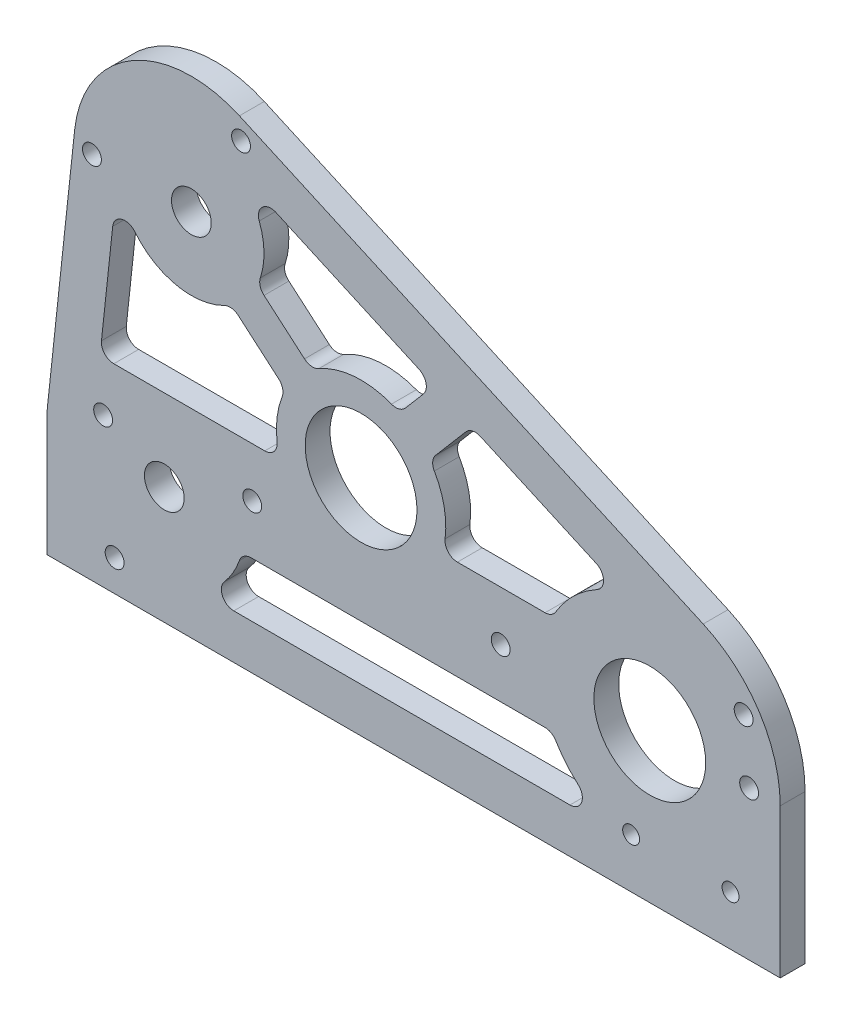
from build123d import *

# Parameters (mm, degrees)
SKETCH1_R           = 14.2875
SKETCH1_R_2         = 12.7
SKETCH1_R_3         = 2.413
SKETCH1_R_4         = 2.159
BOSS_EXTRUDE1_DEPTH = 6.35
BOSS_EXTRUDE2_START = -6.35
SKETCH2_R           = 2.413
SKETCH2_R_2         = 2.685559378
SKETCH2_R_3         = 7.691429031
SKETCH2_R_4         = 5.034548369
SKETCH2_R_5         = 5.920725106
SKETCH2_R_6         = 7.734401209
SKETCH2_R_7         = 5.621863984
SKETCH2_R_8         = 3.605638589
BOSS_EXTRUDE2_DEPTH = 6.35
SKETCH3_R           = 2.413
CUT_EXTRUDE1_DEPTH  = 127.614802212
BOSS_EXTRUDE3_START = -6.35
SKETCH4_R           = 12.7
SKETCH4_R_2         = 5.08
BOSS_EXTRUDE3_DEPTH = 6.35
CUT_EXTRUDE3_DEPTH  = 187.706
FILLET2_R           = 3.175


with BuildPart() as part:
    # Sketch1 → Boss-Extrude1 (new body)
    with BuildSketch(Plane.XY):
        with BuildLine():
            Line((-80.285160074, -57.15), (107.117832745, -57.15))
            Line((107.117832745, -57.15), (107.117832745, -19.05))
            ThreePointArc((107.117832745, -19.05), (101.76765184, -0.936500169), (87.434360611, 11.363096345))
            Line((87.434360611, 11.363096345), (-31.091183717, 64.575405501))
            ThreePointArc((-31.091183717, 64.575405501), (-58.306442976, 63.227904236), (-73.203178923, 40.411827573))
            Line((-73.203178923, 40.411827573), (-80.113730967, -23.950184188))
            ThreePointArc((-80.113730967, -23.950184188), (-80.242272138, -25.549099535), (-80.285160074, -27.1526))
            Line((-80.285160074, -27.1526), (-80.285160074, -57.15))
        make_face()
        Circle(SKETCH1_R, mode=Mode.SUBTRACT)
        with Locations((-43.377208029, 37.209411761)):
            Circle(SKETCH1_R_2, mode=Mode.SUBTRACT)
        with Locations((-50.287760074, -27.1526)):
            Circle(SKETCH1_R_2, mode=Mode.SUBTRACT)
        with Locations((73.780332745, -19.05)):
            Circle(SKETCH1_R, mode=Mode.SUBTRACT)
        with Locations((-68.777208029, 37.209411761)):
            Circle(SKETCH1_R_3, mode=Mode.SUBTRACT)
        with Locations((-17.977208029, 37.209411761)):
            Circle(SKETCH1_R_3, mode=Mode.SUBTRACT)
        with Locations((-56.077208029, 59.206457017)):
            Circle(SKETCH1_R_3, mode=Mode.SUBTRACT)
        with Locations((-30.677208029, 59.206457017)):
            Circle(SKETCH1_R_3, mode=Mode.SUBTRACT)
        with Locations((-56.077208029, 15.212366505)):
            Circle(SKETCH1_R_3, mode=Mode.SUBTRACT)
        with Locations((-30.677208029, 15.212366505)):
            Circle(SKETCH1_R_3, mode=Mode.SUBTRACT)
        with Locations((-62.987760074, -5.155554744)):
            Circle(SKETCH1_R_3, mode=Mode.SUBTRACT)
        with Locations((-75.687760074, -27.1526)):
            Circle(SKETCH1_R_3, mode=Mode.SUBTRACT)
        with Locations((-62.987760074, -49.149645256)):
            Circle(SKETCH1_R_3, mode=Mode.SUBTRACT)
        with Locations((-37.587760074, -49.149645256)):
            Circle(SKETCH1_R_3, mode=Mode.SUBTRACT)
        with Locations((-24.887760074, -27.1526)):
            Circle(SKETCH1_R_3, mode=Mode.SUBTRACT)
        with Locations((-37.587760074, -5.155554744)):
            Circle(SKETCH1_R_3, mode=Mode.SUBTRACT)
        with Locations((94.417832745, -44.45)):
            Circle(SKETCH1_R_4, mode=Mode.SUBTRACT)
        with Locations((97.769463398, -3.524143002)):
            Circle(SKETCH1_R_3, mode=Mode.SUBTRACT)
        with Locations((69.017832745, -44.45)):
            Circle(SKETCH1_R_4, mode=Mode.SUBTRACT)
    extrude(amount=BOSS_EXTRUDE1_DEPTH)

    # Sketch2 → Boss-Extrude2 (add)
    with BuildSketch(Plane.XY.offset(6.35).offset(BOSS_EXTRUDE2_START)):
        with Locations((-56.077208029, 59.206457017)):
            Circle(SKETCH2_R)
        with Locations((-17.977208029, 37.209411761)):
            Circle(SKETCH2_R_2)
        with Locations((-30.677208029, 15.212366505)):
            Circle(SKETCH2_R_3)
        with Locations((-56.077208029, 15.212366505)):
            Circle(SKETCH2_R_4)
        with Locations((-75.687760074, -27.1526)):
            Circle(SKETCH2_R)
        with Locations((-37.587760074, -49.149645256)):
            Circle(SKETCH2_R_5)
        with Locations((-24.887760074, -27.1526)):
            Circle(SKETCH2_R_6)
        with Locations((-37.587760074, -5.155554744)):
            Circle(SKETCH2_R_7)
        with Locations((-62.987760074, -5.155554744)):
            Circle(SKETCH2_R_8)
    extrude(amount=BOSS_EXTRUDE2_DEPTH)

    # Sketch3 → Cut-Extrude1 (cut, through all)
    with BuildSketch(Plane.XY.offset(6.35)):
        with Locations((-65.919667255, -19.05)):
            Circle(SKETCH3_R)
        with Locations((-27.819667255, -19.05)):
            Circle(SKETCH3_R)
        with Locations((99.180332745, -19.05)):
            Circle(SKETCH3_R)
        with Locations((35.680332745, -19.05)):
            Circle(SKETCH3_R)
    extrude(amount=-CUT_EXTRUDE1_DEPTH, mode=Mode.SUBTRACT)

    # Sketch4 → Boss-Extrude3 (add)
    # profile 1 of 2: a face of its own
    with BuildSketch(Plane.XY.offset(6.35).offset(BOSS_EXTRUDE3_START)):
        with Locations((-50.287760074, -27.1526)):
            Circle(SKETCH4_R)
        with Locations((-50.287760074, -27.1526)):
            Circle(SKETCH4_R_2, mode=Mode.SUBTRACT)
    # profile 2 of 2: a face of its own
    with BuildSketch(Plane.XY.offset(6.35).offset(BOSS_EXTRUDE3_START)):
        with Locations((-43.377208029, 37.209411761)):
            Circle(SKETCH4_R)
        with Locations((-43.377208029, 37.209411761)):
            Circle(SKETCH4_R_2, mode=Mode.SUBTRACT)
    extrude(amount=BOSS_EXTRUDE3_DEPTH)

    # Sketch6 → Cut-Extrude3 (cut)
    with BuildSketch(Plane.XY.offset(6.35)):
        with BuildLine():
            Line((48.893516959, -31.75), (-30.494672562, -31.75))
            ThreePointArc((-30.494672562, -31.75), (-34.620223563, -40.092101524), (-42.032213015, -45.72))
            Line((-42.032213015, -45.72), (65.452385819, -45.72))
            ThreePointArc((65.452385819, -45.72), (55.763803098, -40.405286453), (48.893516959, -31.75))
        make_face()
        with BuildLine():
            ThreePointArc((21.645969932, 0), (21.406556056, -3.210509638), (20.69361047, -6.35))
            Line((20.69361047, -6.35), (48.893516959, -6.35))
            ThreePointArc((48.893516959, -6.35), (56.358698753, 2.793311769), (66.933289757, 8.038034302))
            Line((66.933289757, 8.038034302), (28.318236786, 25.374349004))
            Line((28.318236786, 25.374349004), (17.519420156, 12.712904141))
            ThreePointArc((17.519420156, 12.712904141), (20.588502328, 6.682932454), (21.645969932, 0))
        make_face()
        with BuildLine():
            Line((-66.728302826, -6.35), (-20.69361047, -6.35))
            ThreePointArc((-20.69361047, -6.35), (-21.56374561, 1.884911026), (-19.278077532, 9.843969777))
            Line((-19.278077532, 9.843969777), (-33.129659603, 21.725998248))
            ThreePointArc((-33.129659603, 21.725998248), (-53.027504153, 21.346873266), (-61.838499073, 39.191601395))
            Line((-61.838499073, 39.191601395), (-66.728302826, -6.35))
        make_face()
        with BuildLine():
            Line((18.662178143, 29.709458205), (-35.7725647, 54.148058182))
            ThreePointArc((-35.7725647, 54.148058182), (-27.789604023, 47.297768619), (-24.809808029, 37.209411761))
            ThreePointArc((-24.809808029, 37.209411761), (-25.241026709, 33.231061615), (-26.514653067, 29.437501898))
            Line((-26.514653067, 29.437501898), (-12.663070997, 17.555473427))
            ThreePointArc((-12.663070997, 17.555473427), (-1.682532329, 21.580479588), (9.789150952, 19.305971562))
            Line((9.789150952, 19.305971562), (18.662178143, 29.709458205))
        make_face()
    extrude(amount=-CUT_EXTRUDE3_DEPTH, mode=Mode.SUBTRACT)

    # Fillet2
    # the kernel refuses this fillet: 3.175 mm, written as the material it adds along each edge
    with BuildSketch(Plane(origin=(-42.032213015, -45.72, 6.35), x_dir=(0.8036425681302507, 0.5951122773805085, 0), z_dir=(0, 0, -1))) as fillet2_piece_1:
        with BuildLine():
            CenterArc((9.520228984, 3.09914538), FILLET2_R, 126.520636513, 130.92989741)
            Line((7.630747504, 5.650710534), (0, 0))
            ThreePointArc((0, 0), (4.415178659, 0.485469569), (8.830357319, 0))
        make_face()
    extrude(amount=6.35)
    with BuildSketch(Plane(origin=(-30.494672562, -31.75, 6.35), x_dir=(1, 0, 0), z_dir=(0, 0, -1))) as fillet2_piece_2:
        with BuildLine():
            CenterArc((2.37907574, 3.175), FILLET2_R, 199.317995786, 70.682004214)
            ThreePointArc((-0.617162538, 2.124675676), (-0.27964227, 1.070743858), (0, 0))
            Line((0, 0), (2.37907574, 0))
        make_face()
    extrude(amount=6.35)
    with BuildSketch(Plane(origin=(48.893516959, -31.75, 6.35), x_dir=(-1, 0, 0), z_dir=(0, 0, -1))) as fillet2_piece_3:
        with BuildLine():
            CenterArc((1.873744746, -3.175), FILLET2_R, 90, 59.322575527)
            ThreePointArc((-0.856924696, -1.555102041), (-0.416105979, -0.784359884), (0, 0))
            Line((0, 0), (1.873744746, 0))
        make_face()
    extrude(amount=6.35)
    with BuildSketch(Plane(origin=(65.452385819, -45.72, 6.35), x_dir=(-1, 0, 0), z_dir=(0, 0, -1))) as fillet2_piece_4:
        with BuildLine():
            CenterArc((12.071273647, 3.175), FILLET2_R, 130.96571333, 139.03428667)
            ThreePointArc((9.989720528, 5.57244898), (5.283086772, 2.269521282), (0, 0))
            Line((0, 0), (12.071273647, 0))
        make_face()
    extrude(amount=6.35)
    with BuildSketch(Plane(origin=(-26.514653067, 29.437501898, 6.35), x_dir=(0.3669458534357753, 0.9302423021161157, 0), z_dir=(0, 0, -1))) as fillet2_piece_5:
        with BuildLine():
            CenterArc((2.262429591, 3.16999522), FILLET2_R, 199.095946459, 67.686577367)
            Line((-0.737856699, 2.131290651), (0, 0))
            ThreePointArc((0, 0), (1.042114701, 0.029267955), (2.084229403, 0))
        make_face()
    extrude(amount=6.35)
    with BuildSketch(Plane(origin=(-35.7725647, 54.148058182, 6.35), x_dir=(0.9122788554907602, -0.40956963977383487, 0), z_dir=(0, 0, -1))) as fillet2_piece_6:
        with BuildLine():
            CenterArc((15.355975384, 3.175), FILLET2_R, 134.932127283, 135.067872717)
            ThreePointArc((13.113572437, 5.422721963), (7.095274757, 1.409153619), (0, 0))
            Line((0, 0), (15.355975384, 0))
        make_face()
    extrude(amount=6.35)
    with BuildSketch(Plane(origin=(18.662178143, 29.709458205, 6.35), x_dir=(-0.6489239587910223, -0.7608532681844692, 0), z_dir=(0, 0, -1))) as fillet2_piece_7:
        with BuildLine():
            CenterArc((FILLET2_R * 1.33387923601, FILLET2_R), FILLET2_R, 163.717281089, 106.282718911)
            Line((FILLET2_R * 0.373989335277, FILLET2_R * 1.28037720746), (0, 0))
            Line((0, 0), (FILLET2_R * 1.33387923601, 0))
        make_face()
    extrude(amount=6.35)
    with BuildSketch(Plane(origin=(9.789150952, 19.305971562, 6.35), x_dir=(0.648923958791122, 0.7608532681843841, 0), z_dir=(0, 0, -1))) as fillet2_piece_8:
        with BuildLine():
            CenterArc((2.366596481, -3.175), FILLET2_R, 90, 70.574451628)
            ThreePointArc((-0.627664905, -2.119053151), (-0.286770358, -1.067542385), (0, 0))
            Line((0, 0), (2.366596481, 0))
        make_face()
    extrude(amount=6.35)
    with BuildSketch(Plane(origin=(-12.663070997, 17.555473427, 6.35), x_dir=(-0.7590062647283117, 0.6510833204000669, 0), z_dir=(0, 0, -1)), Plane(origin=(17.519420156, 12.712904141, 6.35), x_dir=(0.6489239587910582, 0.7608532681844384, 0), z_dir=(0, 0, -1))) as fillet2_piece_9:
        with BuildLine():
            CenterArc((2.366596481, 3.175), FILLET2_R, 199.425548372, 70.574451628)
            ThreePointArc((-0.627664905, 2.119053151), (-0.286770358, 1.067542385), (0, 0))
            Line((0, 0), (2.366596481, 0))
        make_face()
    extrude(amount=6.35)
    with BuildSketch(Plane(origin=(-61.838499073, 39.191601395, 6.35), x_dir=(-0.10675644594996386, -0.9942852011611821, 0), z_dir=(0, 0, -1))) as fillet2_piece_10:
        with BuildLine():
            CenterArc((15.355975384, -3.175), FILLET2_R, 90, 135.067872717)
            ThreePointArc((13.113572437, -5.422721963), (7.095274757, -1.409153619), (0, 0))
            Line((0, 0), (15.355975384, 0))
        make_face()
    extrude(amount=6.35)
    with BuildSketch(Plane(origin=(-33.129659603, 21.725998248, 6.35), x_dir=(0.7590062647282139, -0.6510833204001809, 0), z_dir=(0, 0, -1))) as fillet2_piece_11:
        with BuildLine():
            CenterArc((2.255400706, 3.175), FILLET2_R, 202.313422633, 67.686577367)
            ThreePointArc((-0.681857828, 1.969538551), (-0.313271514, 0.994344318), (0, 0))
            Line((0, 0), (2.255400706, 0))
        make_face()
    extrude(amount=6.35)
    with BuildSketch(Plane(origin=(-19.278077532, 9.843969777, 6.35), x_dir=(-0.40871289434840824, -0.9126630100937293, 0), z_dir=(0, 0, -1))) as fillet2_piece_12:
        with BuildLine():
            CenterArc((2.372140408, 3.170860102), FILLET2_R, 196.499323021, 70.574451628)
            Line((-0.672122904, 2.269147352), (0, 0))
            ThreePointArc((0, 0), (1.105028222, 0.028224283), (2.210056445, 0))
        make_face()
    extrude(amount=6.35)
    with BuildSketch(Plane(origin=(-20.69361047, -6.35, 6.35), x_dir=(-1, 0, 0), z_dir=(0, 0, -1))) as fillet2_piece_13:
        with BuildLine():
            CenterArc((3.923455223, 3.175), FILLET2_R, 172.650815641, 97.349184359)
            ThreePointArc((0.774537845, 3.581133404), (0.463175795, 1.774149345), (0, 0))
            Line((0, 0), (3.923455223, 0))
        make_face()
    extrude(amount=6.35)
    with BuildSketch(Plane(origin=(-66.728302826, -6.35, 6.35), x_dir=(0.10675644594995837, 0.9942852011611827, 0), z_dir=(0, 0, -1))) as fillet2_piece_14:
        with BuildLine():
            CenterArc((FILLET2_R * 1.11311768963, FILLET2_R), FILLET2_R, 173.871627619, 96.128372381)
            Line((FILLET2_R * 0.118832488469, FILLET2_R * 1.10675644595), (0, 0))
            Line((0, 0), (FILLET2_R * 1.11311768963, 0))
        make_face()
    extrude(amount=6.35)
    with BuildSketch(Plane(origin=(66.933289757, 8.038034302, 6.35), x_dir=(-0.9304446977974599, -0.3664323461985766, 0), z_dir=(0, 0, -1))) as fillet2_piece_15:
        with BuildLine():
            CenterArc((7.514267093, 3.149192718), FILLET2_R, 135.673561463, 127.0162006)
            Line((5.242966133, 5.367709553), (0, 0))
            ThreePointArc((0, 0), (3.555137119, 0.227104084), (7.110274239, 0))
        make_face()
    extrude(amount=6.35)
    with BuildSketch(Plane(origin=(48.893516959, -6.35, 6.35), x_dir=(-1, 0, 0), z_dir=(0, 0, -1))) as fillet2_piece_16:
        with BuildLine():
            CenterArc((1.873744746, 3.175), FILLET2_R, 210.677424473, 59.322575527)
            ThreePointArc((-0.856924696, 1.555102041), (-0.416105979, 0.784359884), (0, 0))
            Line((0, 0), (1.873744746, 0))
        make_face()
    extrude(amount=6.35)
    with BuildSketch(Plane(origin=(20.69361047, -6.35, 6.35), x_dir=(1, 0, 0), z_dir=(0, 0, -1))) as fillet2_piece_17:
        with BuildLine():
            CenterArc((3.923455223, -3.175), FILLET2_R, 90, 97.349184359)
            ThreePointArc((0.774537845, -3.581133404), (0.463175795, -1.774149345), (0, 0))
            Line((0, 0), (3.923455223, 0))
        make_face()
    extrude(amount=6.35)
    with BuildSketch(Plane(origin=(28.318236786, 25.374349004, 6.35), x_dir=(0.9122788554907597, -0.4095696397738357, 0), z_dir=(0, 0, -1))) as fillet2_piece_18:
        with BuildLine():
            CenterArc((FILLET2_R * 0.749693055413, FILLET2_R), FILLET2_R, 196.282718911, 73.717281089)
            Line((-FILLET2_R * 0.210196845325, FILLET2_R * 0.719622792545), (0, 0))
            Line((0, 0), (FILLET2_R * 0.749693055413, 0))
        make_face()
    extrude(amount=6.35)


solid = part.part
